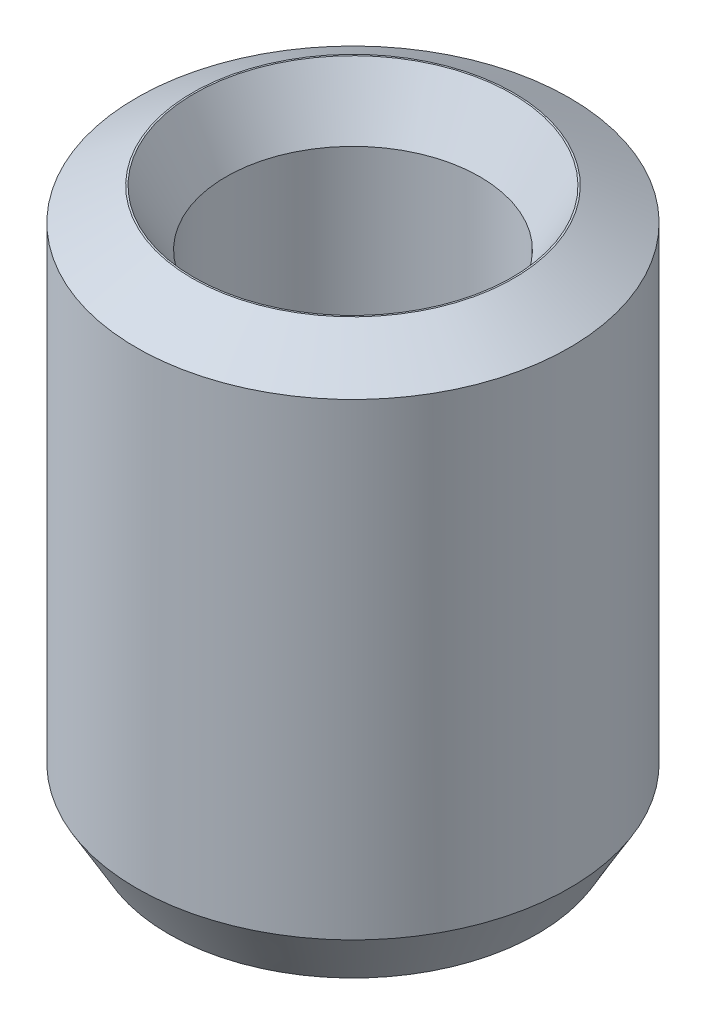
from build123d import *
from OCP.BRepFilletAPI import BRepFilletAPI_MakeChamfer

# Parameters (mm, degrees)
SKETCH1_R           = 25
BOSS_EXTRUDE1_DEPTH = 64.20946141
SKETCH2_R           = 14.656130982
CUT_EXTRUDE1_DEPTH  = 74.299760808
CHAMFER1_SIZE       = 3.716922159
CHAMFER1_SIZE2      = 6.437898028


with BuildPart() as part:
    # Sketch1 → Boss-Extrude1 (new body)
    with BuildSketch(Plane(origin=(0, 0, 0), x_dir=(1, 0, 0), z_dir=(0, 1, 0))):
        Circle(SKETCH1_R)
    extrude(amount=BOSS_EXTRUDE1_DEPTH)

    # Sketch2 → Cut-Extrude1 (cut, through all)
    with BuildSketch(Plane(origin=(0, 0, 0), x_dir=(1, 0, 0), z_dir=(0, 1, 0))):
        Circle(SKETCH2_R)
    extrude(amount=CUT_EXTRUDE1_DEPTH, mode=Mode.SUBTRACT)

    # Chamfer1: one chamfer whose edges measure the first distance from different faces: ONE call of the kernel's chamfer builder (chamfer() names one face for all edges)
    chamfer1_edges_1 = [part.edges().sort_by_distance(p)[0] for p in [
        (-14.656130982, 64.20946141, 0),
    ]]
    chamfer1_side_1 = [part.faces().sort_by_distance(p)[0] for p in [
        (-24.292893219, 64.20946141, 0),
    ]]
    chamfer1_edges_2 = [part.edges().sort_by_distance(p)[0] for p in [
        (-14.656130982, 0, 0),
    ]]
    chamfer1_side_2 = [part.faces().sort_by_distance(p)[0] for p in [
        (-14.656130982, 32.104730705, 0),
    ]]
    chamfer1_edges_3 = [part.edges().sort_by_distance(p)[0] for p in [
        (-25, 0, 0),
    ]]
    chamfer1_side_3 = [part.faces().sort_by_distance(p)[0] for p in [
        (-24.292893219, 0, 0),
    ]]
    chamfer1_edges_4 = [part.edges().sort_by_distance(p)[0] for p in [
        (-25, 64.20946141, 0),
    ]]
    chamfer1_side_4 = [part.faces().sort_by_distance(p)[0] for p in [
        (-25, 32.104730705, 0),
    ]]
    chamfer1 = BRepFilletAPI_MakeChamfer(part.part.solid().wrapped)
    for e in chamfer1_edges_1:
        chamfer1.Add(CHAMFER1_SIZE, CHAMFER1_SIZE2, e.wrapped, chamfer1_side_1[0].wrapped)  # the first distance lies on this face
    for e in chamfer1_edges_2:
        chamfer1.Add(CHAMFER1_SIZE, CHAMFER1_SIZE2, e.wrapped, chamfer1_side_2[0].wrapped)  # the first distance lies on this face
    for e in chamfer1_edges_3:
        chamfer1.Add(CHAMFER1_SIZE, CHAMFER1_SIZE2, e.wrapped, chamfer1_side_3[0].wrapped)  # the first distance lies on this face
    for e in chamfer1_edges_4:
        chamfer1.Add(CHAMFER1_SIZE, CHAMFER1_SIZE2, e.wrapped, chamfer1_side_4[0].wrapped)  # the first distance lies on this face
    add(Compound.cast(chamfer1.Shape()), mode=Mode.REPLACE)


solid = part.part
